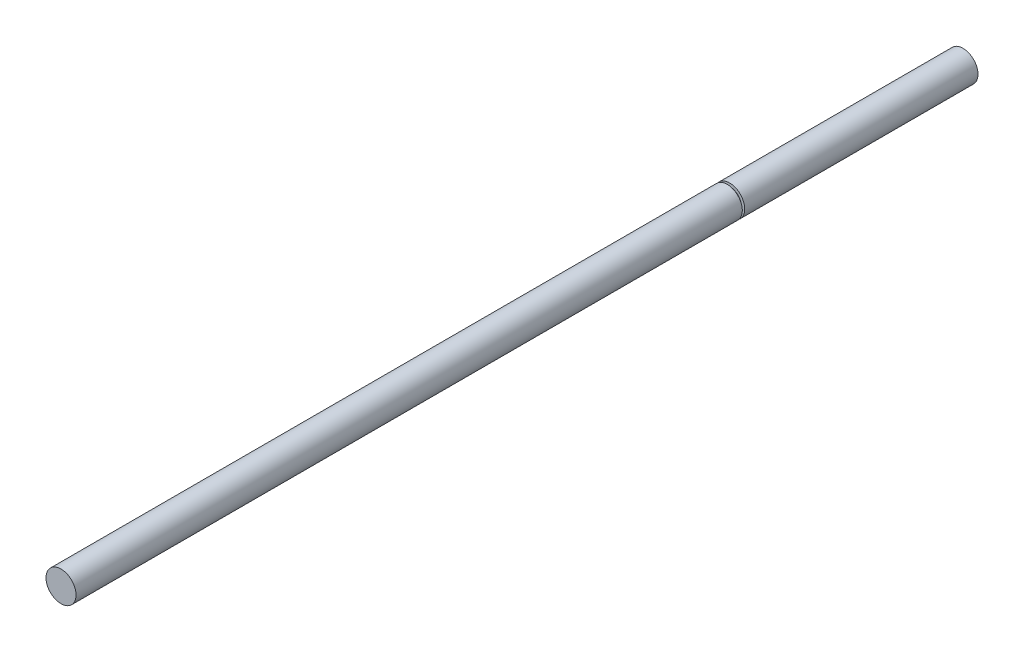
from build123d import *

# Parameters (mm, degrees)
SKETCH1_R           = 3.175
BOSS_EXTRUDE1_DEPTH = 190.5
SKETCH3_R           = 5.037944439
SKETCH3_R_2         = 2.54
CUT_EXTRUDE3_DEPTH  = 0.508


with BuildPart() as part:
    # Sketch1 → Boss-Extrude1 (new body)
    with BuildSketch(Plane.XY):
        Circle(SKETCH1_R)
    extrude(amount=BOSS_EXTRUDE1_DEPTH)

    # Sketch3 → Cut-Extrude3 (cut)
    with BuildSketch(Plane(origin=(0, 0, 49.276), x_dir=(-1, 0, 0), z_dir=(0, 0, -1))):
        Circle(SKETCH3_R)
        Circle(SKETCH3_R_2, mode=Mode.SUBTRACT)
    extrude(amount=-CUT_EXTRUDE3_DEPTH, mode=Mode.SUBTRACT)


solid = part.part
